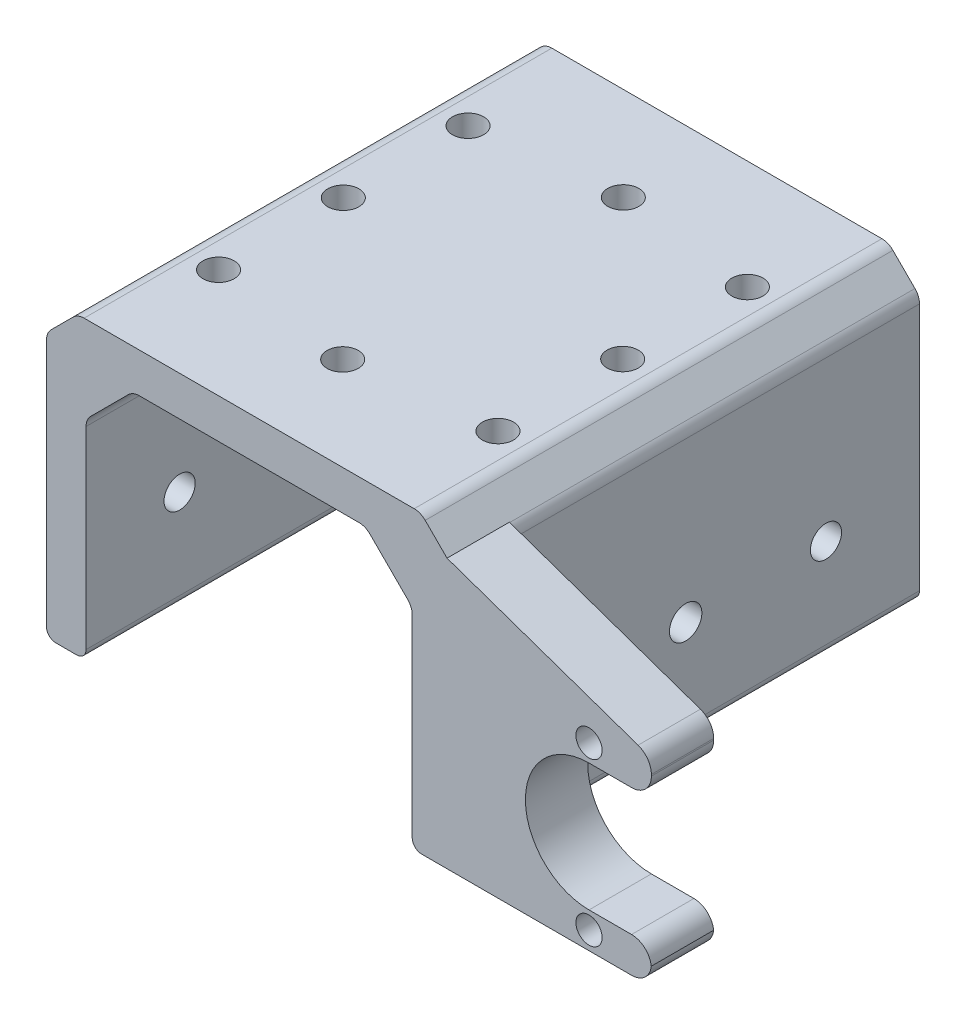
from build123d import *

# Parameters (mm, degrees)
BOSS_EXTRUDE1_DEPTH        = 75
M6X1_0_TAPPED_HOLE1_REACH  = 111.972
M6X1_0_TAPPED_HOLE1_BORE_R = 2.5
M6X1_0_TAPPED_HOLE2_D      = 5
SKETCH8_R                  = 2.6
CUT_EXTRUDE1_DEPTH         = 110.972346069
SKETCH9_W                  = 10
SKETCH9_H                  = 31.74
BOSS_EXTRUDE2_DEPTH        = 32
CUT_EXTRUDE2_REACH         = 128.008
SKETCH10_R                 = 2.1
BOSS_EXTRUDE3_DEPTH        = 10
M6X1_0_TAPPED_HOLE3_D      = 5
M6X1_0_TAPPED_HOLE3_DEPTH  = 13.851
FILLET1_R                  = 3.175
CHAMFER1_SIZE              = 5
FILLET2_R                  = 2.5
FILLET3_R                  = 1.5


with BuildPart() as part:
    # Sketch1 → Boss-Extrude1 (new body)
    with BuildSketch(Plane.XY):
        Polygon((6.35, 33.52), (13.85, 41.02), (51.15, 41.02), (58.65, 33.52), (58.65, 0), (65, 0), (65, 41.02), (65, 47.37), (0, 47.37), (0, 41.02), (0, 0), (6.35, 0), align=None)
    extrude(amount=BOSS_EXTRUDE1_DEPTH)

    # M6x1.0 Tapped Hole1 bore → M6x1.0 Tapped Hole1 (cut, up to next)
    with BuildSketch(Plane.ZY, mode=Mode.PRIVATE) as m6x1_0_tapped_hole1_sk1:
        with Locations((60, 15.87)):
            Circle(M6X1_0_TAPPED_HOLE1_BORE_R)
    m6x1_0_tapped_hole1_tool1 = extrude(m6x1_0_tapped_hole1_sk1.sketch, amount=-M6X1_0_TAPPED_HOLE1_REACH, mode=Mode.PRIVATE) & part.part
    # M6x1.0 Tapped Hole1 bore → M6x1.0 Tapped Hole1 (cut, up to next)
    with BuildSketch(Plane.ZY, mode=Mode.PRIVATE) as m6x1_0_tapped_hole1_sk2:
        with Locations((15, 15.87)):
            Circle(M6X1_0_TAPPED_HOLE1_BORE_R)
    m6x1_0_tapped_hole1_tool2 = extrude(m6x1_0_tapped_hole1_sk2.sketch, amount=-M6X1_0_TAPPED_HOLE1_REACH, mode=Mode.PRIVATE) & part.part
    m6x1_0_tapped_hole1_1 = m6x1_0_tapped_hole1_tool1.solids().sort_by_distance((0, 15.87, 60))[0]
    add(m6x1_0_tapped_hole1_1, mode=Mode.SUBTRACT)
    m6x1_0_tapped_hole1_2 = m6x1_0_tapped_hole1_tool2.solids().sort_by_distance((0, 15.87, 15))[0]
    add(m6x1_0_tapped_hole1_2, mode=Mode.SUBTRACT)
    m6x1_0_tapped_hole1 = m6x1_0_tapped_hole1_1 + m6x1_0_tapped_hole1_2  # M6x1.0 Tapped Hole1 as one shape, for the pattern or mirror that repeats it

    # Mirror1: M6x1.0 Tapped Hole1 across plane
    add(m6x1_0_tapped_hole1.mirror(Plane.ZY.offset(-32.5)), mode=Mode.SUBTRACT)

    # M6x1.0 Tapped Hole2 (through all)
    with Locations(Plane(origin=(0, 47.37, 0), x_dir=(1, 0, 0), z_dir=(0, 1, 0))):
        with Locations((32.5, -15), (32.5, -60)):
            Hole(M6X1_0_TAPPED_HOLE2_D / 2)

    # Sketch8 → Cut-Extrude1 (cut, through all)
    with BuildSketch(Plane.ZY):
        with Locations((37.5, 15.87)):
            Circle(SKETCH8_R)
    extrude(amount=-CUT_EXTRUDE1_DEPTH, mode=Mode.SUBTRACT)

    # Sketch9 → Boss-Extrude2 (add)
    with BuildSketch(Plane(origin=(65, 0, 0), x_dir=(0, 0, -1), z_dir=(1, 0, 0))):
        with Locations((-70, 15.87)):
            Rectangle(SKETCH9_W, SKETCH9_H)
    extrude(amount=BOSS_EXTRUDE2_DEPTH)

    # Sketch10 → Cut-Extrude2 (cut, up to next)
    with BuildSketch(Plane(origin=(0, 0, 65), x_dir=(-1, 0, 0), z_dir=(0, 0, -1)), mode=Mode.PRIVATE) as cut_extrude2_sk1:
        with Locations((-87, 28.87)):
            Circle(SKETCH10_R)
    cut_extrude2_tool1 = extrude(cut_extrude2_sk1.sketch, amount=-CUT_EXTRUDE2_REACH, mode=Mode.PRIVATE) & part.part
    # Sketch10 → Cut-Extrude2 (cut, up to next)
    with BuildSketch(Plane(origin=(0, 0, 65), x_dir=(-1, 0, 0), z_dir=(0, 0, -1)), mode=Mode.PRIVATE) as cut_extrude2_sk2:
        with Locations((-87, 2.87)):
            Circle(SKETCH10_R)
    cut_extrude2_tool2 = extrude(cut_extrude2_sk2.sketch, amount=-CUT_EXTRUDE2_REACH, mode=Mode.PRIVATE) & part.part
    # Sketch10 → Cut-Extrude2 (cut, up to next)
    with BuildSketch(Plane(origin=(0, 0, 65), x_dir=(-1, 0, 0), z_dir=(0, 0, -1)), mode=Mode.PRIVATE) as cut_extrude2_sk3:
        with BuildLine():
            Line((-87, 26.07), (-97, 26.07))
            Line((-97, 26.07), (-97, 5.67))
            Line((-97, 5.67), (-87, 5.67))
            ThreePointArc((-87, 5.67), (-76.8, 15.87), (-87, 26.07))
        make_face()
    cut_extrude2_tool3 = extrude(cut_extrude2_sk3.sketch, amount=-CUT_EXTRUDE2_REACH, mode=Mode.PRIVATE) & part.part
    add(cut_extrude2_tool1.solids().sort_by_distance((87, 28.87, 65))[0], mode=Mode.SUBTRACT)
    add(cut_extrude2_tool2.solids().sort_by_distance((87, 2.87, 65))[0], mode=Mode.SUBTRACT)
    add(cut_extrude2_tool3.solids().sort_by_distance((87.850588, 15.87, 65))[0], mode=Mode.SUBTRACT)

    # Sketch11 → Boss-Extrude3 (add)
    with BuildSketch(Plane.XY.offset(75)):
        Polygon((97, 31.74), (65, 42.87), (65, 31.74), align=None)
    extrude(amount=-BOSS_EXTRUDE3_DEPTH)

    # M6x1.0 Tapped Hole3
    with Locations(Plane(origin=(0, 47.37, 0), x_dir=(1, 0, 0), z_dir=(0, 1, 0))):
        with Locations((54.9, -57.5), (54.9, -37.5), (54.9, -17.5)):
            m6x1_0_tapped_hole3 = Hole(M6X1_0_TAPPED_HOLE3_D / 2, depth=M6X1_0_TAPPED_HOLE3_DEPTH)

    # Mirror2: M6x1.0 Tapped Hole3 across plane
    add(m6x1_0_tapped_hole3.mirror(Plane.ZY.offset(-32.5)), mode=Mode.SUBTRACT)

    # Fillet1
    # the kernel refuses this fillet: 3.175 mm, written as the material it takes off along each edge
    with BuildSketch(Plane(origin=(97, 5.67, 57.0625), x_dir=(0, -1, 0), z_dir=(0, 0, 1)), Plane(origin=(97, 26.07, 57.0625), x_dir=(-1, 0, 0), z_dir=(0, 0, 1))) as fillet1_piece_1:
        with BuildLine():
            CenterArc((FILLET1_R, -FILLET1_R), FILLET1_R, 90, 90)
            Line((0, -FILLET1_R), (0, 0))
            Line((0, 0), (FILLET1_R, 0))
        make_face()
    extrude(amount=25.875, mode=Mode.SUBTRACT)
    with BuildSketch(Plane(origin=(97, 31.74, 59.356851229), x_dir=(0, -1, 0), z_dir=(0, 0, 1))) as fillet1_piece_2:
        with BuildLine():
            CenterArc((FILLET1_R * 0.710947876646, -FILLET1_R), FILLET1_R, 90, 70.821686435)
            Line((-FILLET1_R * 0.233552901866, -FILLET1_R * 0.671490822974), (0, 0))
            Line((0, 0), (FILLET1_R * 0.710947876646, 0))
        make_face()
    extrude(amount=21.286297542, mode=Mode.SUBTRACT)
    with BuildSketch(Plane(origin=(97, 0, 82.9375), x_dir=(-1, 0, 0), z_dir=(0, 0, -1))) as fillet1_piece_3:
        with BuildLine():
            CenterArc((FILLET1_R, FILLET1_R), FILLET1_R, 180, 90)
            Line((0, FILLET1_R), (0, 0))
            Line((0, 0), (FILLET1_R, 0))
        make_face()
    extrude(amount=25.875, mode=Mode.SUBTRACT)

    # Chamfer1
    chamfer1_edges = [part.edges().sort_by_distance(p)[0] for p in [
        (0, 47.37, 37.5),
        (65, 47.37, 37.5),
    ]]
    chamfer(chamfer1_edges, length=CHAMFER1_SIZE)

    # Fillet2
    fillet2_edges = [part.edges().sort_by_distance(p)[0] for p in [
        (0, 42.37, 37.5),
        (60, 47.37, 37.5),
        (5, 47.37, 37.5),
        (65, 42.37, 32.5),
        (58.65, 33.52, 37.5),
        (51.15, 41.02, 37.5),
        (13.85, 41.02, 37.5),
        (6.35, 33.52, 37.5),
    ]]
    fillet(fillet2_edges, radius=FILLET2_R)

    # Fillet3
    fillet3_edges = [part.edges().sort_by_distance(p)[0] for p in [
        (0, 0, 37.5),
        (58.65, 0, 37.5),
        (6.35, 0, 37.5),
        (65, 0, 32.5),
    ]]
    fillet(fillet3_edges, radius=FILLET3_R)


solid = part.part
